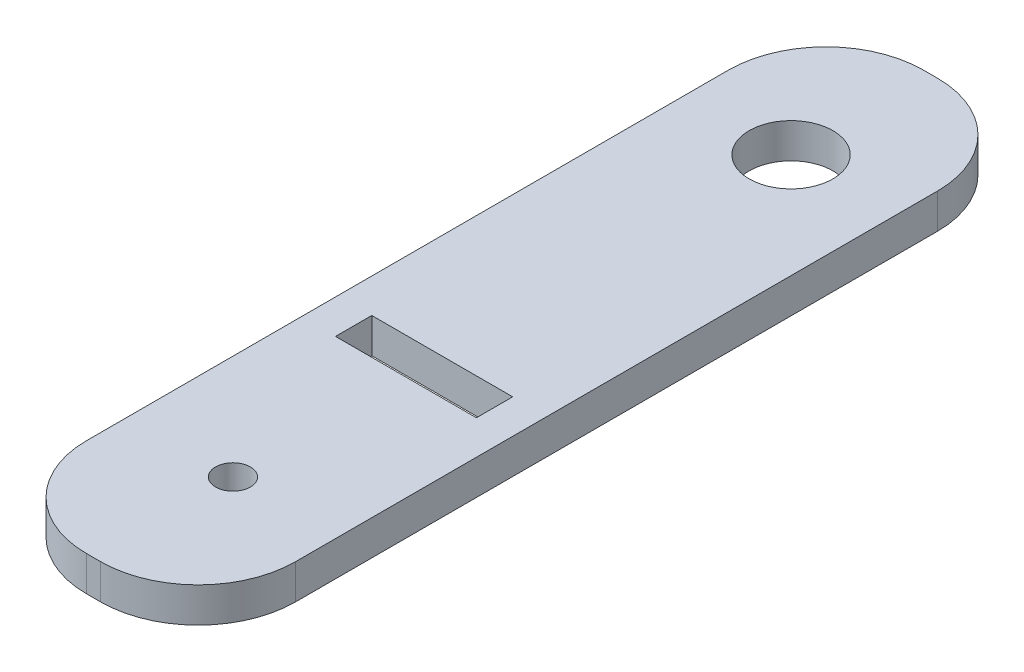
from build123d import *

# Parameters (mm, degrees)
STEM_START                = 6.825155764
STEM_OTHER_SIDE_OUTLINE_W = 12.827
STEM_OTHER_SIDE_OUTLINE_H = 3.302
STEM_OTHER_SIDE_OUTLINE_R = 3.81
STEM_OTHER_SIDE_DEPTH     = 3.175
SKETCH2_R                 = 1.5875
CUT_EXTRUDE1_DEPTH        = 3.175
FILLET1_R                 = 8.89
FILLET2_R                 = 8.89


# Read off the part's stored shape, not the designer's step: Stem Other Side
with BuildPart() as part:
    # Stem Other Side outline → Stem Other Side (new body)
    with BuildSketch(Plane(origin=(0, 0, 0), x_dir=(1, 0, 0), z_dir=(0, 1, 0)).offset(STEM_START)):
        with BuildLine():
            Line((-15.619811821, 34.159467437), (-16.889811821, 34.159467437))
            ThreePointArc((-16.889811821, 34.159467437), (-23.175991106, 31.555646722), (-25.779811821, 25.269467437))
            Line((-25.779811821, 25.269467437), (-25.779811821, -42.040532563))
            Line((-25.779811821, -42.040532563), (-6.729811821, -42.040532563))
            Line((-6.729811821, -42.040532563), (-6.729811821, 25.269467437))
            ThreePointArc((-6.729811821, 25.269467437), (-9.333632536, 31.555646722), (-15.619811821, 34.159467437))
        make_face()
        with Locations((-16.254811821, -11.941532563)):
            Rectangle(STEM_OTHER_SIDE_OUTLINE_W, STEM_OTHER_SIDE_OUTLINE_H, mode=Mode.SUBTRACT)
        with Locations((-16.254811821, 21.459467437)):
            Circle(STEM_OTHER_SIDE_OUTLINE_R, mode=Mode.SUBTRACT)
    extrude(amount=STEM_OTHER_SIDE_DEPTH)

    # Sketch2 → Cut-Extrude1 (cut)
    with BuildSketch(Plane(origin=(0, 10.000155764, 0), x_dir=(1, 0, 0), z_dir=(0, 1, 0))):
        with Locations(Location((-16.254811821, -29.340532563, 0), (0, 0, 270))):
            Circle(SKETCH2_R)
    extrude(amount=-CUT_EXTRUDE1_DEPTH, mode=Mode.SUBTRACT)

    # Fillet1
    fillet1_edges = [part.edges().sort_by_distance(p)[0] for p in [
        (-6.729811821, 8.412655764, 42.040532563),
    ]]
    fillet(fillet1_edges, radius=FILLET1_R)

    # Fillet2
    fillet2_edges = [part.edges().sort_by_distance(p)[0] for p in [
        (-25.779811821, 8.412655764, 42.040532563),
    ]]
    fillet(fillet2_edges, radius=FILLET2_R)


solid = part.part
